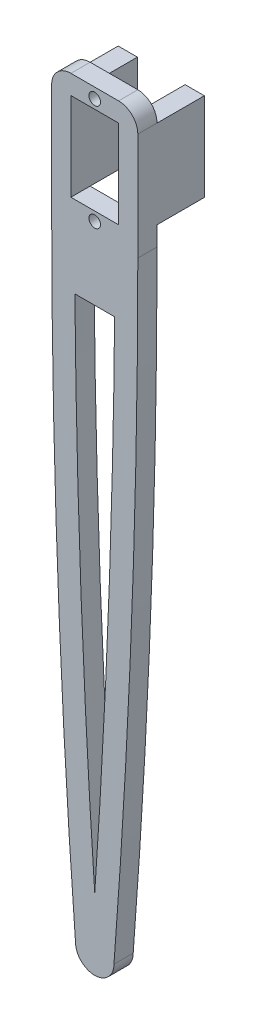
from build123d import *

# Parameters (mm, degrees)
BOSS_EXTRUDE2_DEPTH = 5
SKETCH4_W           = 12.4
SKETCH4_H           = 22.9
CUT_EXTRUDE1_DEPTH  = 5
SKETCH5_R           = 1.5
CUT_EXTRUDE2_DEPTH  = 5
CUT_EXTRUDE3_DEPTH  = 5
SKETCH6_W           = 5
SKETCH6_H           = 22.9
BOSS_EXTRUDE3_DEPTH = 12.3
SKETCH7_R           = 1.5
CUT_EXTRUDE4_DEPTH  = 5


with BuildPart() as part:
    # Sketch1 → Boss-Extrude2 (new body)
    with BuildSketch(Plane.XY):
        with BuildLine():
            Line((-6.2, 16.45), (6.2, 16.45))
            ThreePointArc((6.2, 16.45), (9.735533906, 14.985533906), (11.2, 11.45))
            Line((11.2, 11.45), (11.2, -16.45))
            ThreePointArc((11.2, -16.45), (9.649433537, -97.559262726), (5, -178.55))
            ThreePointArc((5, -178.55), (0, -183.55), (-5, -178.55))
            ThreePointArc((-5, -178.55), (-9.649433537, -97.559262726), (-11.2, -16.45))
            Line((-11.2, -16.45), (-11.2, 11.45))
            ThreePointArc((-11.2, 11.45), (-9.735533906, 14.985533906), (-6.2, 16.45))
        make_face()
    extrude(amount=BOSS_EXTRUDE2_DEPTH)

    # Sketch4 → Cut-Extrude1 (cut)
    with BuildSketch(Plane.XY.offset(5)):
        Rectangle(SKETCH4_W, SKETCH4_H)
    extrude(amount=-CUT_EXTRUDE1_DEPTH, mode=Mode.SUBTRACT)

    # Sketch5 → Cut-Extrude2 (cut)
    with BuildSketch(Plane.XY.offset(5)):
        with Locations((0, 13.8)):
            Circle(SKETCH5_R)
        with Locations((0, -13.8)):
            Circle(SKETCH5_R)
    extrude(amount=-CUT_EXTRUDE2_DEPTH, mode=Mode.SUBTRACT)

    # 3DSketch1 → Cut-Extrude3 (cut)
    with BuildSketch(Plane(origin=(-5.160423987, -32.686439405, 5), x_dir=(0.03897452460138957, -0.9992402045715013, 0), z_dir=(0, 0, 1))):
        with BuildLine():
            Line((0, 0), (0.402250143, 10.313006243))
            add(Edge.make_bspline(
                [(132.405052787, 0), (132.33638536, 0.007627552), (132.26771744, 0.015250757), (132.19904902, 0.022869576), (126.769998736, 0.624873123), (121.337777255, 1.198987474), (115.971798773, 1.743277878), (102.55225111, 3.059162741), (89.125108856, 4.291856269), (81.065896409, 4.997231834), (64.94123124, 6.330918517), (48.803313346, 7.493309622), (40.731510594, 8.035951572), (27.824174172, 8.848610973), (14.911969374, 9.58457196), (10.076236862, 9.846020434), (5.23968635, 10.089957993), (0.402250143, 10.313006243)],
                knots=[0, 0, 0, 0, 0, 0, 0.002323761, 0.002323761, 0.002323761, 0.183719441, 0.183719441, 0.183719441, 0.455812961, 0.455812961, 0.455812961, 0.72790648, 0.72790648, 0.72790648, 0.890780205, 0.890780205, 0.890780205, 0.890780205, 0.890780205, 0.890780205], degree=5))
            add(Edge.make_bspline(
                [(0, 0), (4.840113133, -0.15441643), (9.680970327, -0.287938029), (14.522375928, -0.403938196), (27.452676969, -0.675942436), (40.384098451, -0.871102077), (48.473645133, -0.958819983), (64.653074032, -1.056939836), (80.832632652, -0.983252259), (88.922302572, -0.907750283), (102.404667084, -0.724639456), (115.885939838, -0.457998492), (121.278011015, -0.333316775), (126.738446926, -0.184061374), (132.197893558, -0.0067545), (132.266946789, -0.004507398), (132.335999865, -0.002255886), (132.405052787, 0)],
                knots=[0.109219795, 0.109219795, 0.109219795, 0.109219795, 0.109219795, 0.109219795, 0.27209352, 0.27209352, 0.27209352, 0.544187039, 0.544187039, 0.544187039, 0.816280559, 0.816280559, 0.816280559, 0.997676239, 0.997676239, 0.997676239, 1, 1, 1, 1, 1, 1], degree=5))
        make_face()
    extrude(amount=-CUT_EXTRUDE3_DEPTH, mode=Mode.SUBTRACT)

    # Sketch6 → Boss-Extrude3 (add)
    with BuildSketch(Plane(origin=(0, 0, 0), x_dir=(-1, 0, 0), z_dir=(0, 0, -1))):
        with Locations((-8.7, 0)):
            Rectangle(SKETCH6_W, SKETCH6_H)
        with Locations((8.7, 0)):
            Rectangle(SKETCH6_W, SKETCH6_H)
    extrude(amount=BOSS_EXTRUDE3_DEPTH)

    # Sketch7 → Cut-Extrude4 (cut)
    with BuildSketch(Plane(origin=(0, 0, -12.3), x_dir=(-1, 0, 0), z_dir=(0, 0, -1))):
        with Locations((-8.665838134, 0)):
            Circle(SKETCH7_R)
        with Locations((8.880503913, 0)):
            Circle(SKETCH7_R)
    extrude(amount=-CUT_EXTRUDE4_DEPTH, mode=Mode.SUBTRACT)


solid = part.part
